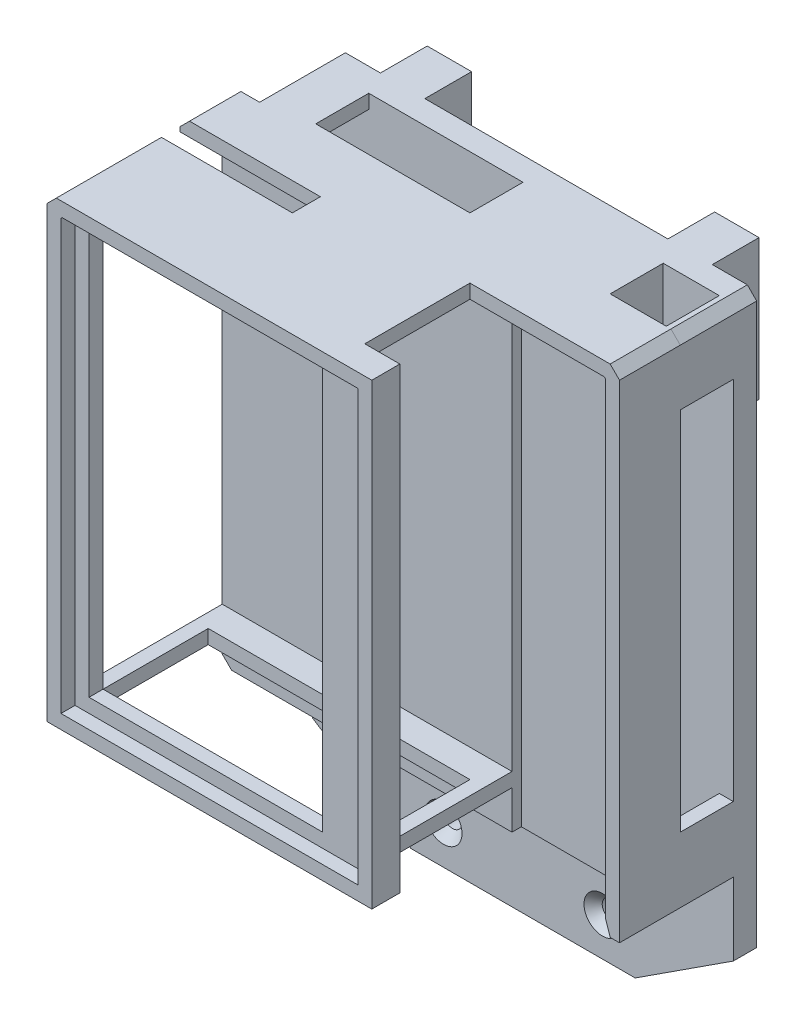
from build123d import *

# Parameters (mm, degrees)
BOSS_EXTRUDE1_DEPTH           = 5
CHAMFER1_SIZE                 = 2
SKETCH4_W                     = 12
SKETCH4_H                     = 3
BOSS_EXTRUDE2_DEPTH           = 11.35
BOSS_EXTRUDE3_DEPTH           = 4
BOSS_EXTRUDE4_DEPTH           = 11.35
CHAMFER2_START                = 116.672618896
CHAMFER2_OUTLINE_W            = 5
CHAMFER2_OUTLINE_H            = 5.65
CHAMFER2_DEPTH                = 2.327381104
CUT_EXTRUDE2_DEPTH            = 2
BOSS_EXTRUDE5_DEPTH           = 9
BOSS_EXTRUDE6_DEPTH           = 12
SKETCH11_W                    = 3
SKETCH11_H                    = 100.242640687
BOSS_EXTRUDE7_DEPTH           = 9
CHAMFER3_SIZE                 = 2
SKETCH12_W                    = 21
SKETCH12_H                    = 5
CUT_EXTRUDE3_DEPTH            = 9
CHAMFER5_SIZE                 = 4.996701125
CHAMFER5_SIZE_2               = 2.33
SKETCH13_W                    = 12
SKETCH13_H                    = 11.35
CUT_EXTRUDE4_DEPTH            = 117
SKETCH14_W                    = 3
SKETCH14_H                    = 11.35
BOSS_EXTRUDE8_DEPTH           = 7
BOSS_EXTRUDE9_START           = 85.242641
SKETCH14_2_W                  = 3
SKETCH14_2_H                  = 11.35
BOSS_EXTRUDE9_DEPTH           = 8
SKETCH15_W                    = 9
SKETCH15_H                    = 92
CUT_EXTRUDE5_DEPTH            = 10
BOSS_EXTRUDE10_START          = -9
SKETCH16_W                    = 62
SKETCH16_H                    = 3
BOSS_EXTRUDE10_DEPTH          = 31.5
BOSS_EXTRUDE12_DEPTH          = 6
SKETCH18_W                    = 50
SKETCH18_H                    = 86
CUT_EXTRUDE6_DEPTH            = 6
CUT_EXTRUDE7_DEPTH            = 3
SKETCH20_W                    = 6
SKETCH20_H                    = 98
CUT_EXTRUDE8_DEPTH            = 3
BOSS_EXTRUDE13_DEPTH          = 10.5
SKETCH22_W                    = 3
SKETCH22_H                    = 92
BOSS_EXTRUDE14_DEPTH          = 3
CUT_EXTRUDE9_START            = -2
CUT_EXTRUDE9_DEPTH            = 10
CUT_EXTRUDE10_DEPTH           = 9
SKETCH25_W                    = 9.5
SKETCH25_H                    = 30
BOSS_EXTRUDE15_DEPTH          = 10
CSK_FOR_M4_SFHCS2_D           = 4
CSK_FOR_M4_SFHCS2_DEPTH       = 13
CSK_FOR_M4_SFHCS2_CSINK_D     = 7.9
CSK_FOR_M4_SFHCS2_CSINK_ANGLE = 90
CSK_FOR_M4_SFHCS2_TIP         = 1.201721238
CHAMFER6_SIZE                 = 2
CHAMFER6_SIZE_2               = 4.289013841
SKETCH30_W                    = 56
SKETCH30_H                    = 25.5
CUT_EXTRUDE11_DEPTH           = 18.5
SKETCH32_W                    = 30
SKETCH32_H                    = 6
CUT_EXTRUDE13_DEPTH           = 10
CSK_FOR_M4_SFHCS3_D           = 4
CSK_FOR_M4_SFHCS3_DEPTH       = 19
CSK_FOR_M4_SFHCS3_CSINK_D     = 7.9
CSK_FOR_M4_SFHCS3_CSINK_ANGLE = 90
CSK_FOR_M4_SFHCS3_TIP         = 1.201721238
F_4_0MM_DOWEL_HOLE1_D         = 4


with BuildPart() as part:
    # Sketch2 → Boss-Extrude1 (new body)
    with BuildSketch(Plane.XY):
        Polygon((-45, 122), (-45, 0.197559457), (-24, -13.44), (24, -13.44), (45, 0.197559457), (45, 122), align=None)
    extrude(amount=BOSS_EXTRUDE1_DEPTH)

    # Chamfer1
    chamfer1_edges = [part.edges().sort_by_distance(p)[0] for p in [
        (45, 122, 2.5),
        (-45, 122, 2.5),
    ]]
    chamfer(chamfer1_edges, length=CHAMFER1_SIZE)

    # Sketch4 → Boss-Extrude2 (add)
    with BuildSketch(Plane.XY.offset(5)):
        Polygon((-45, 120), (-43, 122), (-33, 122), (-33, 119), (-41.757359313, 119), (-42, 118.757359313), (-45, 118.757359313), align=None)
        with Locations((-39, 17.257359313)):
            Rectangle(SKETCH4_W, SKETCH4_H)
        Polygon((0, 122), (30, 122), (30, 108), (27, 108), (27, 119), (0, 119), align=None)
        Polygon((0, 15.757359313), (30, 15.757359313), (30, 29.757359313), (27, 29.757359313), (27, 18.757359313), (0, 18.757359313), align=None)
    extrude(amount=BOSS_EXTRUDE2_DEPTH)

    # Sketch5 → Boss-Extrude3 (add)
    with BuildSketch(Plane.XY.offset(16.35)):
        Polygon((45, 15.757359313), (-45, 15.757359313), (-45, 120), (-43, 122), (45, 122), align=None)
    extrude(amount=BOSS_EXTRUDE3_DEPTH)

    # Sketch6 → Boss-Extrude4 (add)
    with BuildSketch(Plane.XY.offset(5)):
        Polygon((38, 122), (43, 122), (45, 120), (45, 115), (42, 115), (42, 118.757359313), (41.757359313, 119), (38, 119), align=None)
        Polygon((45, 15.757359313), (39, 15.757359313), (39, 18.757359313), (42, 18.757359313), (42, 21.757359313), (45, 21.757359313), align=None)
    extrude(amount=BOSS_EXTRUDE4_DEPTH)

    # Chamfer2: read off the stored shape, not the designer's step
    # Chamfer2 outline → Chamfer2 (cut)
    with BuildSketch(Plane(origin=(0, 0, 0), x_dir=(0.7071067811865474, -0.7071067811865477, 0), z_dir=(0.7071067811865476, 0.7071067811865476, 0)).offset(CHAMFER2_START)):
        with Locations((-54.5, -19.175)):
            Rectangle(CHAMFER2_OUTLINE_W, CHAMFER2_OUTLINE_H)
    extrude(amount=CHAMFER2_DEPTH, mode=Mode.SUBTRACT)

    # Sketch8 → Cut-Extrude2 (cut)
    with BuildSketch(Plane.XY.offset(20.35)):
        Polygon((-45, 15.757359313), (-37, 15.757359313), (-37, 122), (-43, 122), (-45, 120), align=None)
    extrude(amount=-CUT_EXTRUDE2_DEPTH, mode=Mode.SUBTRACT)

    # Sketch9 → Boss-Extrude5 (add)
    with BuildSketch(Plane.XY.offset(20.35)):
        Polygon((-37, 18.757359313), (42, 18.757359313), (42, 118.757359313), (41.757359313, 119), (-37, 119), (-37, 122), (43, 122), (45, 120), (45, 15.757359313), (-37, 15.757359313), align=None)
    extrude(amount=BOSS_EXTRUDE5_DEPTH)

    # Sketch10 → Boss-Extrude6 (add)
    with BuildSketch(Plane.ZY.offset(37)):
        Polygon((18.35, 15.757359313), (29.35, 15.757359313), (29.35, 18.757359313), (20.35, 18.757359313), (20.35, 119), (29.35, 119), (29.35, 122), (18.35, 122), align=None)
    extrude(amount=BOSS_EXTRUDE6_DEPTH)

    # Sketch11 → Boss-Extrude7 (add)
    with BuildSketch(Plane.XY.offset(20.35)):
        with Locations((-47.5, 68.878679657)):
            Rectangle(SKETCH11_W, SKETCH11_H)
    extrude(amount=BOSS_EXTRUDE7_DEPTH)

    # Chamfer3
    chamfer3_edges = [part.edges().sort_by_distance(p)[0] for p in [
        (-49, 15.757359313, 23.85),
        (-49, 122, 23.85),
    ]]
    chamfer(chamfer3_edges, length=CHAMFER3_SIZE)

    # Sketch12 → Cut-Extrude3 (cut)
    with BuildSketch(Plane(origin=(0, 18.757359313, 0), x_dir=(1, 0, 0), z_dir=(0, 1, 0))):
        with Locations((27.5, -22.85)):
            Rectangle(SKETCH12_W, SKETCH12_H)
    extrude(amount=-CUT_EXTRUDE3_DEPTH, mode=Mode.SUBTRACT)

    # Chamfer5
    # the kernel refuses this chamfer: 4.996701125, 2.33 mm, written as the material it takes off along each edge
    with BuildSketch(Plane(origin=(38, 18.757359313, 20.35), x_dir=(1, 0, 0), z_dir=(0, 0, 1))) as chamfer5_piece_1_section:
        Polygon((CHAMFER5_SIZE, 0), (0, -CHAMFER5_SIZE_2), (0, 0), align=None)
    chamfer5_piece_1 = extrude(amount=5, mode=Mode.PRIVATE)
    chamfer5_piece_1 = split(chamfer5_piece_1, bisect_by=Plane(origin=(42, 18.757359313, 20.35), z_dir=(-1, 0, 0)), keep=Keep.TOP, mode=Mode.PRIVATE)
    add(chamfer5_piece_1, mode=Mode.SUBTRACT)
    with BuildSketch(Plane(origin=(17, 18.757359313, 25.35), x_dir=(-1, 0, 0), z_dir=(0, 0, -1))) as chamfer5_piece_2:
        Polygon((CHAMFER5_SIZE, 0), (0, -CHAMFER5_SIZE_2), (0, 0), align=None)
    extrude(amount=5, mode=Mode.SUBTRACT)

    # Sketch13 → Cut-Extrude4 (cut)
    with BuildSketch(Plane(origin=(0, 122, 0), x_dir=(1, 0, 0), z_dir=(0, 1, 0))):
        with Locations((36, -10.675)):
            Rectangle(SKETCH13_W, SKETCH13_H)
    extrude(amount=-CUT_EXTRUDE4_DEPTH, mode=Mode.SUBTRACT)

    # Sketch14 → Boss-Extrude8 (add)
    with BuildSketch(Plane.XZ.offset(-115)):
        with Locations((43.5, 10.675)):
            Rectangle(SKETCH14_W, SKETCH14_H)
    extrude(amount=BOSS_EXTRUDE8_DEPTH)

    # Sketch14<2> → Boss-Extrude9 (add)
    with BuildSketch(Plane.XZ.offset(-115).offset(BOSS_EXTRUDE9_START)):
        with Locations((43.5, 10.675)):
            Rectangle(SKETCH14_2_W, SKETCH14_2_H)
    extrude(amount=BOSS_EXTRUDE9_DEPTH)

    # Sketch15 → Cut-Extrude5 (cut)
    with BuildSketch(Plane.ZY.offset(49)):
        with Locations((24.85, 73)):
            Rectangle(SKETCH15_W, SKETCH15_H)
    extrude(amount=-CUT_EXTRUDE5_DEPTH, mode=Mode.SUBTRACT)

    # Sketch16 → Boss-Extrude10 (add)
    with BuildSketch(Plane.XY.offset(29.35).offset(BOSS_EXTRUDE10_START)):
        Polygon((13, 122), (13, 119), (-49, 119), (-49, 120), (-47, 122), align=None)
        with Locations((-18, 25.5)):
            Rectangle(SKETCH16_W, SKETCH16_H)
    extrude(amount=BOSS_EXTRUDE10_DEPTH)

    # Sketch17 → Boss-Extrude12 (add)
    with BuildSketch(Plane.XY.offset(51.85)):
        Polygon((-49, 119), (-49, 27), (-49, 24), (13, 24), (13, 27), (13, 119), (13, 122), (-47, 122), (-49, 120), align=None)
    extrude(amount=BOSS_EXTRUDE12_DEPTH)

    # Sketch18 → Cut-Extrude6 (cut)
    with BuildSketch(Plane.XY.offset(57.85)):
        with Locations((-18, 73)):
            Rectangle(SKETCH18_W, SKETCH18_H)
    extrude(amount=-CUT_EXTRUDE6_DEPTH, mode=Mode.SUBTRACT)

    # Sketch19 → Cut-Extrude7 (cut)
    with BuildSketch(Plane.XY.offset(57.85)):
        Polygon((10, 119), (-45.757359313, 119), (-46, 118.757359313), (-46, 27), (10, 27), align=None)
    extrude(amount=-CUT_EXTRUDE7_DEPTH, mode=Mode.SUBTRACT)

    # Sketch20 → Cut-Extrude8 (cut)
    with BuildSketch(Plane(origin=(13, 0, 0), x_dir=(0, 0, -1), z_dir=(1, 0, 0))):
        with Locations((-54.85, 73)):
            Rectangle(SKETCH20_W, SKETCH20_H)
    extrude(amount=-CUT_EXTRUDE8_DEPTH, mode=Mode.SUBTRACT)

    # Sketch21 → Boss-Extrude13 (add)
    with BuildSketch(Plane(origin=(10, 0, 0), x_dir=(0, 0, -1), z_dir=(1, 0, 0))):
        Polygon((-57.85, 27), (-57.85, 24), (-51.85, 24), (-51.85, 27), (-51.85, 119), (-51.85, 122), (-57.85, 122), (-57.85, 119), (-54.85, 119), (-54.85, 27), align=None)
    extrude(amount=BOSS_EXTRUDE13_DEPTH)

    # Sketch22 → Boss-Extrude14 (add)
    with BuildSketch(Plane.XY.offset(54.85)):
        with Locations((19, 73)):
            Rectangle(SKETCH22_W, SKETCH22_H)
    extrude(amount=BOSS_EXTRUDE14_DEPTH)

    # Sketch23 → Cut-Extrude9 (cut)
    with BuildSketch(Plane.XY.offset(20.35).offset(CUT_EXTRUDE9_START)):
        Polygon((13, 15.757359313), (13, 119), (41.757359313, 119), (42, 118.757359313), (42, 15.757359313), align=None)
    extrude(amount=CUT_EXTRUDE9_DEPTH, mode=Mode.SUBTRACT)

    # Sketch24 → Cut-Extrude10 (cut)
    with BuildSketch(Plane.XY.offset(29.35)):
        Polygon((43, 15.757359313), (42, 18.757359313), (-46, 18.757359313), (-46, 24), (-49, 24), (-49, 17.757359313), (-47, 15.757359313), align=None)
    extrude(amount=-CUT_EXTRUDE10_DEPTH, mode=Mode.SUBTRACT)

    # Sketch25 → Boss-Extrude15 (add)
    with BuildSketch(Plane(origin=(0, 0, 0), x_dir=(-1, 0, 0), z_dir=(0, 0, -1))):
        with Locations((30.75, 107)):
            Rectangle(SKETCH25_W, SKETCH25_H)
        with Locations((-30.75, 107)):
            Rectangle(SKETCH25_W, SKETCH25_H)
    extrude(amount=BOSS_EXTRUDE15_DEPTH)

    # CSK for M4 SFHCS2
    with Locations(Plane(origin=(-695.683007616, 1385.247292614, 5), x_dir=(1, 0, 0), z_dir=(0, 0, 1))):
        with Locations((678.683007616, -1390.467292614), (712.683007616, -1390.467292614)):
            CounterSinkHole(CSK_FOR_M4_SFHCS2_D / 2, CSK_FOR_M4_SFHCS2_CSINK_D / 2, depth=CSK_FOR_M4_SFHCS2_DEPTH, counter_sink_angle=CSK_FOR_M4_SFHCS2_CSINK_ANGLE)
            with Locations((0, 0, -(CSK_FOR_M4_SFHCS2_DEPTH + CSK_FOR_M4_SFHCS2_TIP / 2))):  # 118° drill point
                Cone(0, CSK_FOR_M4_SFHCS2_D / 2, CSK_FOR_M4_SFHCS2_TIP, mode=Mode.SUBTRACT)

    # Chamfer6
    # the kernel refuses this chamfer: 4.289013841, 2 mm, written as the material it adds along each edge
    with BuildSketch(Plane(origin=(-45, 131.112729659, 18.35), x_dir=(0, 0, -1), z_dir=(0, -1, 0))) as chamfer6_piece_1_section:
        Polygon((CHAMFER6_SIZE, 0), (0, -CHAMFER6_SIZE_2), (0, 0), align=None)
    chamfer6_piece_1 = extrude(amount=115.355370346, mode=Mode.PRIVATE)
    chamfer6_piece_1 = split(chamfer6_piece_1, bisect_by=Plane(origin=(-49, 131.112729659, 18.35), z_dir=(1, 0, 0)), keep=Keep.TOP, mode=Mode.PRIVATE)
    chamfer6_piece_1 = split(chamfer6_piece_1, bisect_by=Plane(origin=(-39.443635171, 125.556364829, 18.35), z_dir=(0.7071067811865476, -0.7071067811865476, 0)), keep=Keep.TOP, mode=Mode.PRIVATE)
    chamfer6_piece_1 = split(chamfer6_piece_1, bisect_by=Plane(origin=(-103.677685173, 72.435044486, 18.35), z_dir=(0.7071067811865476, 0.7071067811865476, 0)), keep=Keep.TOP, mode=Mode.PRIVATE)
    add(chamfer6_piece_1)

    # Sketch30 → Cut-Extrude11 (cut)
    with BuildSketch(Plane(origin=(-695.683007616, 24, -941.083024415), x_dir=(1, 0, 0), z_dir=(0, -1, 0))):
        with Locations((677.683007616, 980.183024415)):
            Rectangle(SKETCH30_W, SKETCH30_H)
    extrude(amount=-CUT_EXTRUDE11_DEPTH, mode=Mode.SUBTRACT)

    # Sketch32 → Cut-Extrude13 (cut)
    with BuildSketch(Plane(origin=(0, 122, 0), x_dir=(1, 0, 0), z_dir=(0, 1, 0))):
        with Locations((-34, -32.35)):
            Rectangle(SKETCH32_W, SKETCH32_H)
    extrude(amount=-CUT_EXTRUDE13_DEPTH, mode=Mode.SUBTRACT)

    # CSK for M4 SFHCS3
    with Locations(Plane(origin=(45, 1385.247292614, -941.083024415), x_dir=(0, 1, 0), z_dir=(1, 0, 0))):
        with Locations((-1278.247292614, 936.083024415)):
            CounterSinkHole(CSK_FOR_M4_SFHCS3_D / 2, CSK_FOR_M4_SFHCS3_CSINK_D / 2, depth=CSK_FOR_M4_SFHCS3_DEPTH, counter_sink_angle=CSK_FOR_M4_SFHCS3_CSINK_ANGLE)
            with Locations((0, 0, -(CSK_FOR_M4_SFHCS3_DEPTH + CSK_FOR_M4_SFHCS3_TIP / 2))):  # 118° drill point
                Cone(0, CSK_FOR_M4_SFHCS3_D / 2, CSK_FOR_M4_SFHCS3_TIP, mode=Mode.SUBTRACT)

    # Ø4.0mm Dowel Hole1 (through all)
    with Locations(Plane.ZY.offset(35.5)):
        with Locations((-5, 107)):
            Hole(F_4_0MM_DOWEL_HOLE1_D / 2)


solid = part.part
